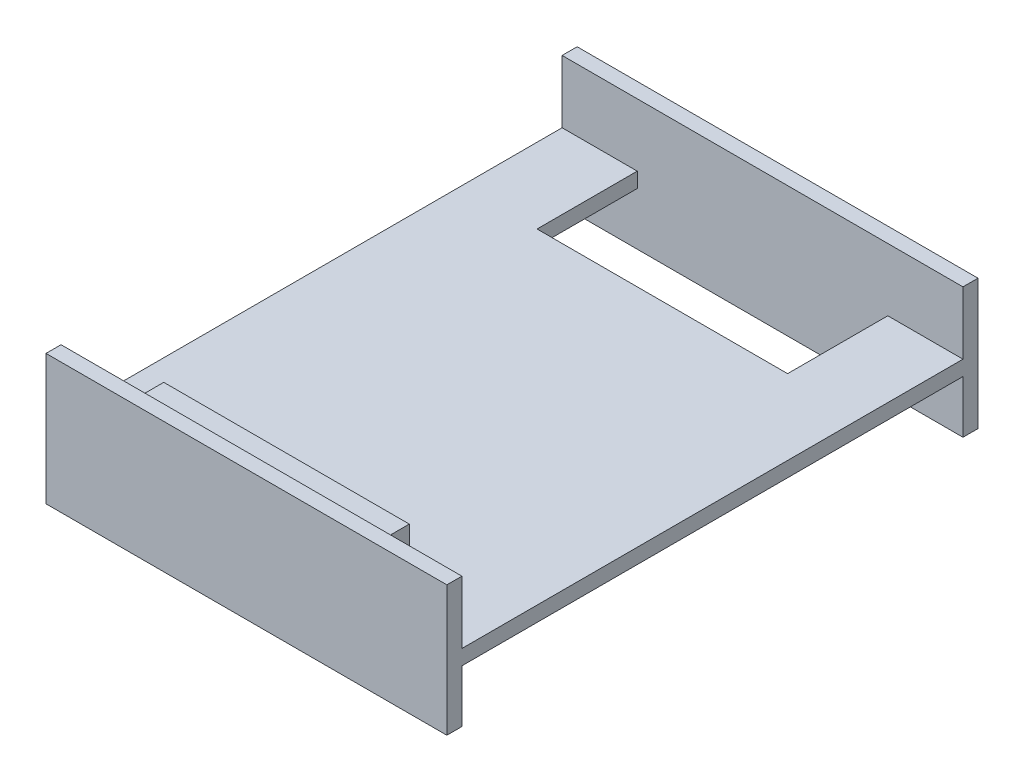
from build123d import *

# Parameters (mm, degrees)
EXTRUDE_309_DEPTH     = 1.2
SKETCH_2_W            = 32
SKETCH_2_H            = 1.2
PCB_DEPTH             = 5
PCB_2_DEPTH           = 4.5
CUT_EXTRUDE_990_REACH = 54.406
SKETCH_5_W            = 32
SKETCH_5_H            = 1.2
EXTRUDE_1262_DEPTH    = 4.2


with BuildPart() as part:
    # 草图1 → Extrude 309 (new body)
    with BuildSketch(Plane(origin=(0, 0, 0), x_dir=(1, 0, 0), z_dir=(0, 1, 0))):
        Polygon((32, 0), (32, 40), (32, 41.2), (0, 41.2), (0, 40), (0, 0), (0, -1.2), (32, -1.2), align=None)
    extrude(amount=EXTRUDE_309_DEPTH)

    # 草图2 → PCB (add)
    with BuildSketch(Plane(origin=(0, 1.2, 0), x_dir=(1, 0, 0), z_dir=(0, 1, 0))):
        with Locations((16, -0.6)):
            Rectangle(SKETCH_2_W, SKETCH_2_H)
        with Locations((16, 40.6)):
            Rectangle(SKETCH_2_W, SKETCH_2_H)
    extrude(amount=PCB_DEPTH)

    # 草图3 → PCB 2 (add)
    with BuildSketch(Plane(origin=(0, 1.2, 0), x_dir=(1, 0, 0), z_dir=(0, 1, 0))):
        Polygon((16, 0), (25.8, 0), (25.8, 2), (6.2, 2), (6.2, 0), align=None)
    extrude(amount=PCB_2_DEPTH)

    # 草图4 → Cut-Extrude 990 (cut, up to next)
    with BuildSketch(Plane(origin=(0, 1.2, 0), x_dir=(1, 0, 0), z_dir=(0, 1, 0)), mode=Mode.PRIVATE) as cut_extrude_990_sk1:
        Polygon((16, 40), (26, 40), (26, 32), (6, 32), (6, 40), align=None)
    cut_extrude_990_tool1 = extrude(cut_extrude_990_sk1.sketch, amount=-CUT_EXTRUDE_990_REACH, mode=Mode.PRIVATE) & part.part
    add(cut_extrude_990_tool1.solids().sort_by_distance((16, 1.2, -36))[0], mode=Mode.SUBTRACT)

    # 草图5 → Extrude 1262 (add)
    with BuildSketch(Plane.XZ):
        with Locations((16, 0.6)):
            Rectangle(SKETCH_5_W, SKETCH_5_H)
        with Locations((16, -40.6)):
            Rectangle(SKETCH_5_W, SKETCH_5_H)
    extrude(amount=EXTRUDE_1262_DEPTH)


solid = part.part
